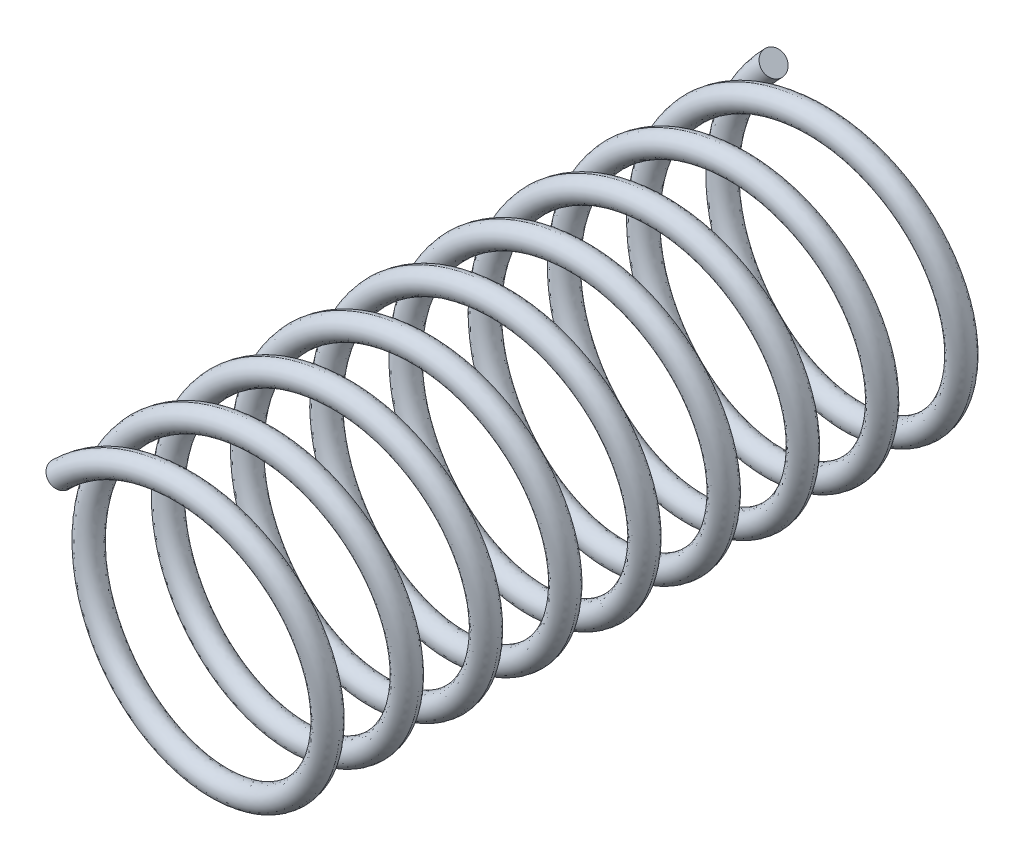
from build123d import *

# Parameters (mm, degrees)
SWEEP_1_PITCH       = 2
SWEEP_1_HEIGHT      = 18
SWEEP_1_RADIUS      = 3.5
SWEEP_1_START_ANGLE = 45
SKETCH_2_R          = 0.3


with BuildPart() as part:
    # 扫描1: sweep along a helix
    with BuildLine() as sweep_1_path:
        add(Helix(SWEEP_1_PITCH, SWEEP_1_HEIGHT, SWEEP_1_RADIUS, center=(0, 0, 0), direction=(0, 0, -1), mode=Mode.PRIVATE).rotate(Axis((0, 0, 0), (0, 0, -1)), SWEEP_1_START_ANGLE))
    # 草图2 → 扫描1 (sweep)
    with BuildSketch(Plane(origin=(0, 0, 0), x_dir=(1, 0, 0), z_dir=(0, 1, 0))):
        with Locations((3.5, 0.750000011)):
            Circle(SKETCH_2_R)
    sweep(path=sweep_1_path.line, is_frenet=True)


solid = part.part
